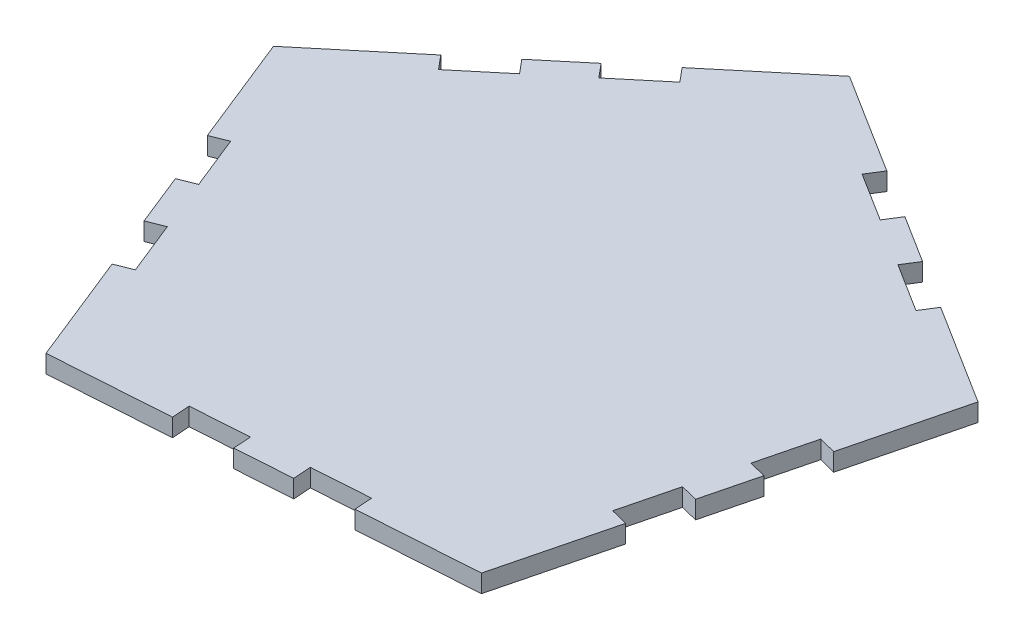
from build123d import *

# Parameters (mm, degrees)
BOSS_EXTRUDE1_DEPTH = 3.18
CUT_EXTRUDE1_DEPTH  = 87.044973388
CIRPATTERN1_COUNT   = 5


with BuildPart() as part:
    # Sketch1 → Boss-Extrude1 (new body)
    with BuildSketch(Plane(origin=(0, 0, 0), x_dir=(1, 0, 0), z_dir=(0, 1, 0))):
        Polygon((-59.925822748, 15.118064705), (-32.896231583, -52.321105303), (39.594833528, -47.454286112), (57.367184482, 22.992743574), (-4.139963679, 61.664583135), align=None)
    extrude(amount=BOSS_EXTRUDE1_DEPTH)

    # Sketch2 → Cut-Extrude1 (cut, through all)
    with BuildSketch(Plane.XZ):
        Polygon((-52.073329945, 4.47400363), (-49.121588617, 3.290946939), (-45.319437868, 12.777360891), (-48.271179196, 13.960417582), align=None)
        Polygon((-44.550875136, 23.242623015), (-40.748724387, 32.729036968), (-37.796983059, 31.545980277), (-41.599133808, 22.059566324), align=None)
    cut_extrude1 = extrude(amount=-CUT_EXTRUDE1_DEPTH, mode=Mode.SUBTRACT)

    # CirPattern1: Cut-Extrude1 ×5 about axis
    cirpattern1_axis = Axis((0, 3.339, 0), (0, -1, 0))
    for i in range(1, CIRPATTERN1_COUNT):
        add(cut_extrude1.rotate(cirpattern1_axis, i * 360 / CIRPATTERN1_COUNT), mode=Mode.SUBTRACT)


solid = part.part
